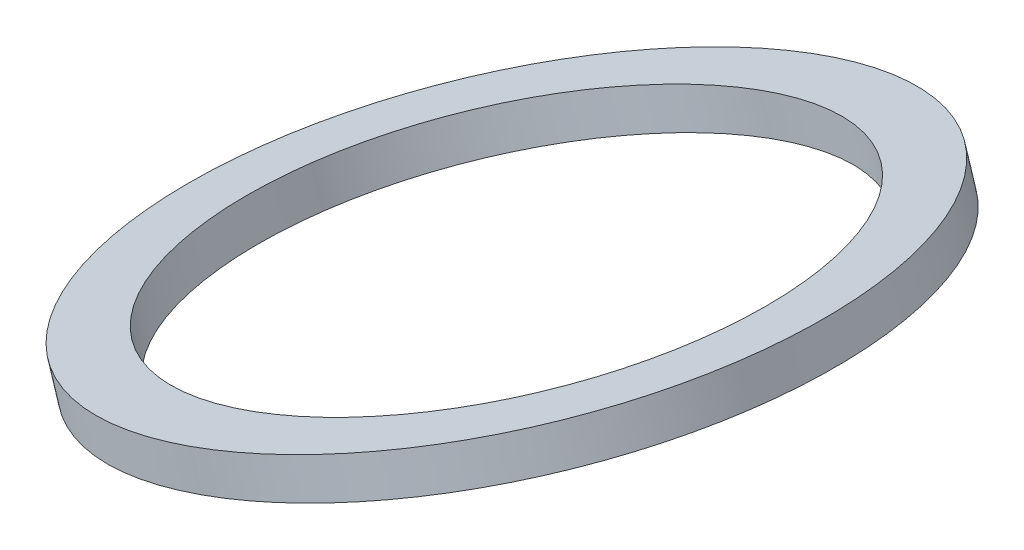
from build123d import *


with BuildPart() as part:
    # Sk_Arandela → Arandela (revolve)
    with BuildSketch(Plane.XY):
        Polygon((372.818828515, 556.950499693), (375.870714198, 557.912785398), (376.472142764, 556.005356846), (373.42025708, 555.043071141), align=None)
    revolve(axis=Axis((357.677142955, 557.418856831, 0), (0.3007142826457737, -0.9537142759825071, 0)))


solid = part.part
